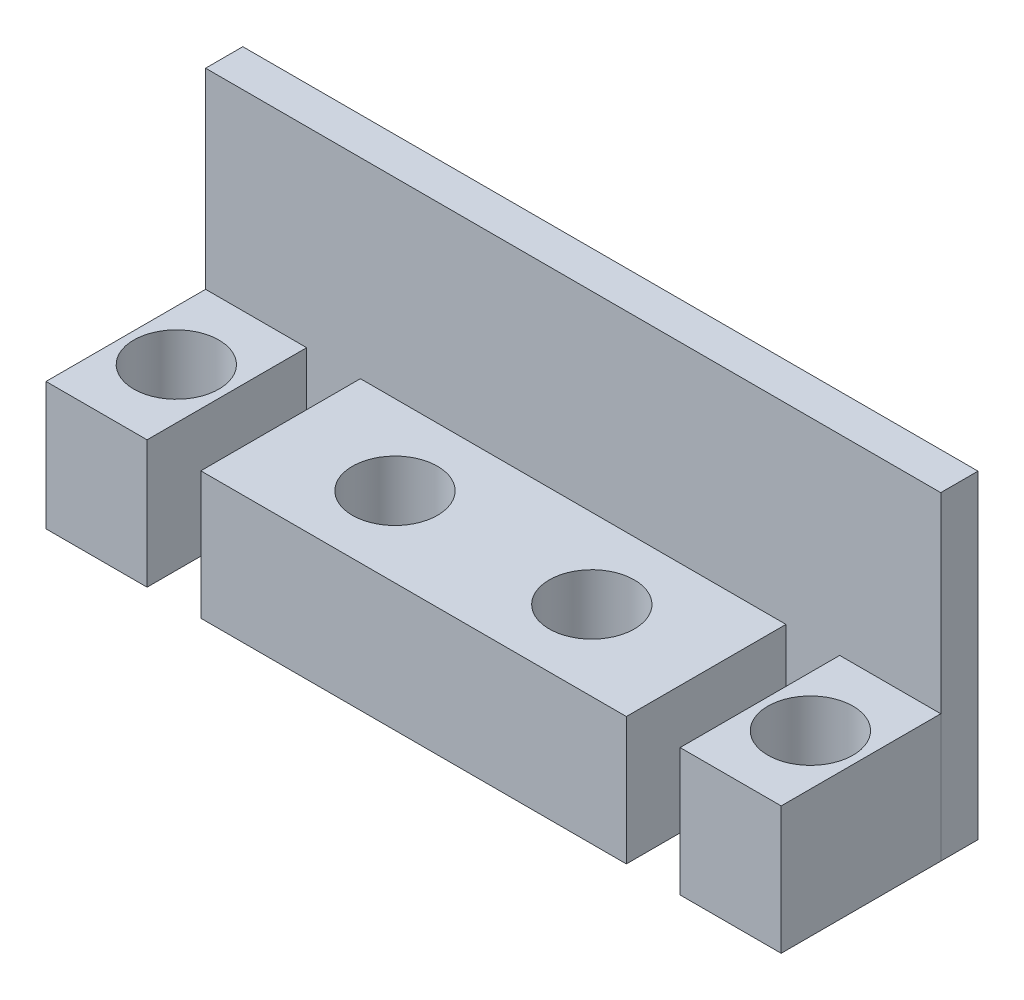
from build123d import *

# Parameters (mm, degrees)
SKETCH1_W                = 40
SKETCH1_H                = 15
SKETCH1_R                = 4
BOSS_EXTRUDE1_DEPTH      = 12
SKETCH1_W_2              = 9.5
BOSS_EXTRUDE1_2_DEPTH    = 12
BOSS_EXTRUDE1_3_DEPTH    = 12
BOSS_EXTRUDE2_DEPTH      = 34.55
BOSS_EXTRUDE2_DEPTH_BACK = 34.55
SKETCH2_W                = 3.5
SKETCH2_H                = 30


with BuildPart() as part:
    # Sketch1 → Boss-Extrude1 (new body)
    with BuildSketch(Plane(origin=(0, 0, 0), x_dir=(1, 0, 0), z_dir=(0, 1, 0))):
        with Locations((20, 7.5)):
            Rectangle(SKETCH1_W, SKETCH1_H)
        with Locations((10.75, 7.5)):
            Circle(SKETCH1_R, mode=Mode.SUBTRACT)
        with Locations((29.25, 7.5)):
            Circle(SKETCH1_R, mode=Mode.SUBTRACT)
    extrude(amount=BOSS_EXTRUDE1_DEPTH)

    # Sketch2 → Boss-Extrude2 (add, two sides: drawn at the far end of the back side and taken through both)
    with BuildSketch(Plane.ZY.offset(-20).offset(-BOSS_EXTRUDE2_DEPTH_BACK)):
        with Locations((-16.75, 15)):
            Rectangle(SKETCH2_W, SKETCH2_H)
    extrude(amount=BOSS_EXTRUDE2_DEPTH + BOSS_EXTRUDE2_DEPTH_BACK)


with BuildPart() as body_2:
    # Sketch1 → Boss-Extrude1 2 (new body)
    with BuildSketch(Plane(origin=(0, 0, 0), x_dir=(1, 0, 0), z_dir=(0, 1, 0))):
        with Locations((49.8, 7.5)):
            Rectangle(SKETCH1_W_2, SKETCH1_H)
        with Locations((49.8, 7.5)):
            Circle(SKETCH1_R, mode=Mode.SUBTRACT)
    extrude(amount=BOSS_EXTRUDE1_2_DEPTH)


with BuildPart() as body_3:
    # Sketch1 → Boss-Extrude1 3 (new body)
    with BuildSketch(Plane(origin=(0, 0, 0), x_dir=(1, 0, 0), z_dir=(0, 1, 0))):
        with Locations((-9.8, 7.5)):
            Rectangle(SKETCH1_W_2, SKETCH1_H)
        with Locations((-9.8, 7.5)):
            Circle(SKETCH1_R, mode=Mode.SUBTRACT)
    extrude(amount=BOSS_EXTRUDE1_3_DEPTH)


solid = Compound([part.part, body_2.part, body_3.part])
